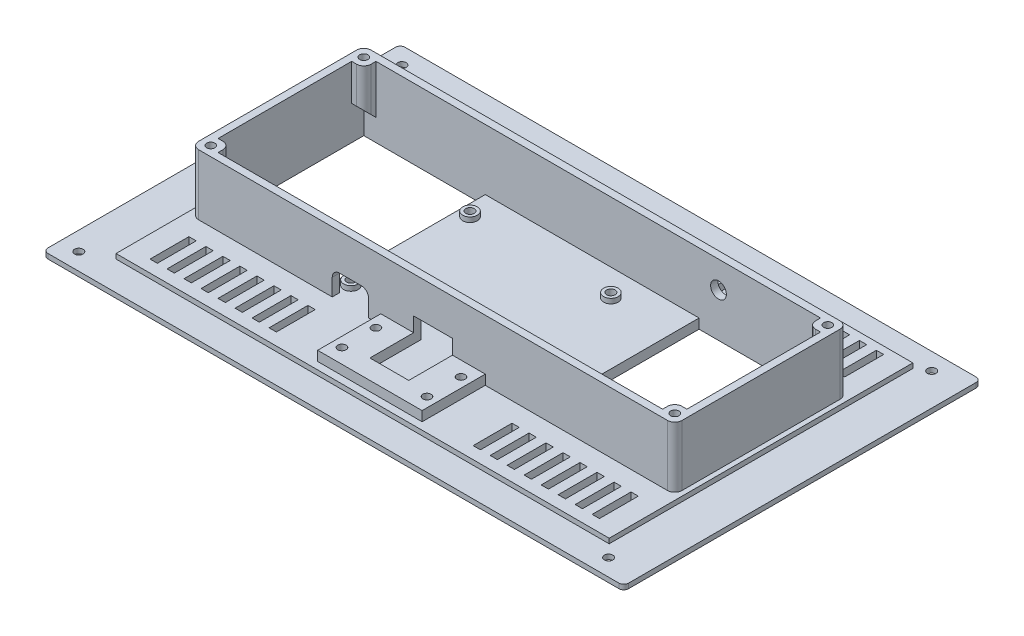
from build123d import *

# Parameters (mm, degrees)
SKIZZE1_W                            = 239
SKIZZE1_H                            = 147
AUFSATZ_LINEAR_AUSTRAGEN1_DEPTH      = 4
SKIZZE5_R                            = 3
AUFSATZ_LINEAR_AUSTRAGEN3_DEPTH      = 2
SKIZZE2_W                            = 199
SKIZZE2_H                            = 71
SKIZZE2_W_2                          = 193
SKIZZE2_H_2                          = 65
AUFSATZ_LINEAR_AUSTRAGEN2_DEPTH      = 25
SKIZZE3_W                            = 50
SKIZZE3_H                            = 65
SKIZZE3_W_2                          = 55
SCHNITT_LINEAR_AUSTRAGEN1_DEPTH      = 282.700195243
F_3_5_3_5_DURCHMESSER_BOHRUNG1_D     = 3.5
F_3_5_3_5_DURCHMESSER_BOHRUNG2_D     = 3.5
SCHNITT_LINEAR_AUSTRAGEN2_REACH      = 265.055
SKIZZE10_W                           = 15
SKIZZE10_H                           = 10
VERRUNDUNG2_R                        = 3
SCHNITT_LINEAR_AUSTRAGEN3_REACH      = 267.53
SKIZZE11_R                           = 3.25
SKIZZE12_W                           = 5
SKIZZE12_H                           = 5
AUFSATZ_LINEAR_AUSTRAGEN4_DEPTH      = 20
FASE1_SIZE                           = 5
F_3_4_3_4_DURCHMESSER_BOHRUNG1_D     = 3.4
F_3_4_3_4_DURCHMESSER_BOHRUNG1_DEPTH = 8
F_3_4_3_4_DURCHMESSER_BOHRUNG1_TIP   = 1.021463052
VERRUNDUNG3_R                        = 3
SKIZZE17_W                           = 43
SKIZZE17_H                           = 26
AUFSATZ_LINEAR_AUSTRAGEN5_DEPTH      = 4
F_3_4_3_4_DURCHMESSER_BOHRUNG2_D     = 3.4
F_3_4_3_4_DURCHMESSER_BOHRUNG2_DEPTH = 6
F_3_4_3_4_DURCHMESSER_BOHRUNG2_TIP   = 1.021463052
SCHNITT_LINEAR_AUSTRAGEN4_DEPTH      = 6
SCHNITT_LINEAR_AUSTRAGEN4_DEPTH_BACK = 4
SKIZZE20_W                           = 16
SKIZZE20_H                           = 21
SCHNITT_LINEAR_AUSTRAGEN5_REACH      = 283.7
SKIZZE21_W                           = 3
SKIZZE21_H                           = 16
LINEARES_MUSTER1_COUNT               = 27
LINEARES_MUSTER1_PITCH               = 7
SCHNITT_LINEAR_AUSTRAGEN6_REACH      = 283.7
SKIZZE22_W                           = 3
SKIZZE22_H                           = 16
LINEARES_MUSTER2_COUNT               = 8
LINEARES_MUSTER2_PITCH               = 7
SCHNITT_LINEAR_AUSTRAGEN7_REACH      = 283.7
SKIZZE23_W                           = 3
SKIZZE23_H                           = 16
LINEARES_MUSTER3_COUNT               = 8
LINEARES_MUSTER3_PITCH               = 7
SKIZZE24_W                           = 239
SKIZZE24_H                           = 147
SKIZZE24_W_2                         = 203
SKIZZE24_H_2                         = 125
SCHNITT_LINEAR_AUSTRAGEN8_DEPTH      = 2
VERRUNDUNG4_R                        = 2


with BuildPart() as part:
    # Skizze1 → Aufsatz-Linear austragen1 (new body)
    with BuildSketch(Plane(origin=(0, 0, 0), x_dir=(1, 0, 0), z_dir=(0, 1, 0))):
        with Locations((119.5, 73.5)):
            Rectangle(SKIZZE1_W, SKIZZE1_H)
    extrude(amount=AUFSATZ_LINEAR_AUSTRAGEN1_DEPTH)

    # Skizze5 → Aufsatz-Linear austragen3 (add)
    with BuildSketch(Plane(origin=(0, 4, 0), x_dir=(1, 0, 0), z_dir=(0, 1, 0))):
        with Locations(Location((77.72, 98, 0), (0, 0, 270))):
            Circle(SKIZZE5_R)
        with Locations(Location((135.72, 98, 0), (0, 0, 270))):
            Circle(SKIZZE5_R)
        with Locations(Location((77.72, 49, 0), (0, 0, 270))):
            Circle(SKIZZE5_R)
        with Locations(Location((135.72, 49, 0), (0, 0, 270))):
            Circle(SKIZZE5_R)
    extrude(amount=AUFSATZ_LINEAR_AUSTRAGEN3_DEPTH)

    # Skizze2 → Aufsatz-Linear austragen2 (add)
    with BuildSketch(Plane(origin=(0, 4, 0), x_dir=(1, 0, 0), z_dir=(0, 1, 0))):
        with Locations((119.5, 76.5)):
            Rectangle(SKIZZE2_W, SKIZZE2_H)
        with Locations((119.5, 76.5)):
            Rectangle(SKIZZE2_W_2, SKIZZE2_H_2, mode=Mode.SUBTRACT)
    extrude(amount=AUFSATZ_LINEAR_AUSTRAGEN2_DEPTH)

    # Skizze3 → Schnitt-Linear austragen1 (cut, through all)
    with BuildSketch(Plane(origin=(0, 4, 0), x_dir=(1, 0, 0), z_dir=(0, 1, 0))):
        with Locations((48, 76.5)):
            Rectangle(SKIZZE3_W, SKIZZE3_H)
        with Locations((188.5, 76.5)):
            Rectangle(SKIZZE3_W_2, SKIZZE3_H)
    extrude(amount=-SCHNITT_LINEAR_AUSTRAGEN1_DEPTH, mode=Mode.SUBTRACT)

    # Ø3.5 (3.5) Durchmesser Bohrung1 (through all)
    with Locations(Plane(origin=(0, 4, 0), x_dir=(1, 0, 0), z_dir=(0, 1, 0))):
        with Locations((7.67, 140), (225.77, 140), (225.77, 7), (7.67, 7)):
            Hole(F_3_5_3_5_DURCHMESSER_BOHRUNG1_D / 2)

    # Ø3.5 (3.5) Durchmesser Bohrung2 (through all)
    with Locations(Plane(origin=(0, 6, 0), x_dir=(1, 0, 0), z_dir=(0, 1, 0))):
        with Locations((77.72, 98), (135.72, 98), (135.72, 49), (77.72, 49)):
            Hole(F_3_5_3_5_DURCHMESSER_BOHRUNG2_D / 2)

    # Skizze10 → Schnitt-Linear austragen2 (cut, up to next)
    with BuildSketch(Plane.XY.offset(-41), mode=Mode.PRIVATE) as schnitt_linear_austragen2_sk1:
        with Locations((85.5, 9)):
            Rectangle(SKIZZE10_W, SKIZZE10_H)
    schnitt_linear_austragen2_tool1 = extrude(schnitt_linear_austragen2_sk1.sketch, amount=-SCHNITT_LINEAR_AUSTRAGEN2_REACH, mode=Mode.PRIVATE) & part.part
    add(schnitt_linear_austragen2_tool1.solids().sort_by_distance((85.5, 9, -41))[0], mode=Mode.SUBTRACT)

    # Verrundung2
    verrundung2_edges = [part.edges().sort_by_distance(p)[0] for p in [
        (78, 14, -42.5),
        (93, 14, -42.5),
    ]]
    fillet(verrundung2_edges, radius=VERRUNDUNG2_R)

    # Skizze11 → Schnitt-Linear austragen3 (cut, up to next)
    with BuildSketch(Plane(origin=(0, 0, -112), x_dir=(-1, 0, 0), z_dir=(0, 0, -1)), mode=Mode.PRIVATE) as schnitt_linear_austragen3_sk1:
        with Locations((-169, 18)):
            Circle(SKIZZE11_R)
    schnitt_linear_austragen3_tool1 = extrude(schnitt_linear_austragen3_sk1.sketch, amount=-SCHNITT_LINEAR_AUSTRAGEN3_REACH, mode=Mode.PRIVATE) & part.part
    add(schnitt_linear_austragen3_tool1.solids().sort_by_distance((169, 18, -112))[0], mode=Mode.SUBTRACT)

    # Skizze12 → Aufsatz-Linear austragen4 (add)
    with BuildSketch(Plane(origin=(0, 29, 0), x_dir=(1, 0, 0), z_dir=(0, 1, 0))):
        with Locations((25.5, 106.5)):
            Rectangle(SKIZZE12_W, SKIZZE12_H)
        with Locations((25.5, 46.5)):
            Rectangle(SKIZZE12_W, SKIZZE12_H)
        with Locations((213.5, 106.5)):
            Rectangle(SKIZZE12_W, SKIZZE12_H)
        with Locations((213.5, 46.5)):
            Rectangle(SKIZZE12_W, SKIZZE12_H)
    extrude(amount=-AUFSATZ_LINEAR_AUSTRAGEN4_DEPTH)

    # Fase1
    fase1_edges = [part.edges().sort_by_distance(p)[0] for p in [
        (25.5, 9, -104),
        (25.5, 9, -49),
        (213.5, 9, -49),
        (213.5, 9, -104),
    ]]
    chamfer(fase1_edges, length=FASE1_SIZE - 0.0001)  # a hair under: the kernel refuses the full size

    # Ø3.4 (3.4) Durchmesser Bohrung1
    with Locations(Plane(origin=(0, 29, 0), x_dir=(1, 0, 0), z_dir=(0, 1, 0))):
        with Locations((24, 108), (215, 108), (215, 45), (24, 45)):
            Hole(F_3_4_3_4_DURCHMESSER_BOHRUNG1_D / 2, depth=F_3_4_3_4_DURCHMESSER_BOHRUNG1_DEPTH)
            with Locations((0, 0, -(F_3_4_3_4_DURCHMESSER_BOHRUNG1_DEPTH + F_3_4_3_4_DURCHMESSER_BOHRUNG1_TIP / 2))):  # 118° drill point
                Cone(0, F_3_4_3_4_DURCHMESSER_BOHRUNG1_D / 2, F_3_4_3_4_DURCHMESSER_BOHRUNG1_TIP, mode=Mode.SUBTRACT)

    # Verrundung3
    verrundung3_edges = [part.edges().sort_by_distance(p)[0] for p in [
        (28, 21.49995, -49),
        (211, 21.49995, -49),
        (211, 21.49995, -104),
        (28, 21.49995, -104),
        (20, 16.5, -112),
        (20, 16.5, -41),
        (219, 16.5, -41),
        (219, 16.5, -112),
    ]]
    fillet(verrundung3_edges, radius=VERRUNDUNG3_R)

    # Skizze17 → Aufsatz-Linear austragen5 (add)
    with BuildSketch(Plane(origin=(0, 4, 0), x_dir=(1, 0, 0), z_dir=(0, 1, 0))):
        with Locations((119.5, 28)):
            Rectangle(SKIZZE17_W, SKIZZE17_H)
    extrude(amount=AUFSATZ_LINEAR_AUSTRAGEN5_DEPTH)

    # Ø3.4 (3.4) Durchmesser Bohrung2
    with Locations(Plane(origin=(0, 8, 0), x_dir=(1, 0, 0), z_dir=(0, 1, 0))):
        with Locations((102, 35), (137, 35), (137, 21), (102, 21)):
            Hole(F_3_4_3_4_DURCHMESSER_BOHRUNG2_D / 2, depth=F_3_4_3_4_DURCHMESSER_BOHRUNG2_DEPTH)
            with Locations((0, 0, -(F_3_4_3_4_DURCHMESSER_BOHRUNG2_DEPTH + F_3_4_3_4_DURCHMESSER_BOHRUNG2_TIP / 2))):  # 118° drill point
                Cone(0, F_3_4_3_4_DURCHMESSER_BOHRUNG2_D / 2, F_3_4_3_4_DURCHMESSER_BOHRUNG2_TIP, mode=Mode.SUBTRACT)

    # Skizze20 → Schnitt-Linear austragen4 (cut, two sides: drawn at the far end of the back side and taken through both)
    with BuildSketch(Plane(origin=(0, 8, 0), x_dir=(1, 0, 0), z_dir=(0, 1, 0)).offset(-SCHNITT_LINEAR_AUSTRAGEN4_DEPTH_BACK)):
        with Locations((119.5, 33.5)):
            Rectangle(SKIZZE20_W, SKIZZE20_H)
    extrude(amount=SCHNITT_LINEAR_AUSTRAGEN4_DEPTH + SCHNITT_LINEAR_AUSTRAGEN4_DEPTH_BACK, mode=Mode.SUBTRACT)

    # Skizze21 → Schnitt-Linear austragen5 (cut, up to next)
    with BuildSketch(Plane(origin=(0, 4, 0), x_dir=(1, 0, 0), z_dir=(0, 1, 0)), mode=Mode.PRIVATE) as schnitt_linear_austragen5_sk1:
        with Locations((28.5, 126)):
            Rectangle(SKIZZE21_W, SKIZZE21_H)
    schnitt_linear_austragen5_tool1 = extrude(schnitt_linear_austragen5_sk1.sketch, amount=-SCHNITT_LINEAR_AUSTRAGEN5_REACH, mode=Mode.PRIVATE) & part.part
    schnitt_linear_austragen5 = schnitt_linear_austragen5_tool1.solids().sort_by_distance((28.5, 4, -126))[0]
    add(schnitt_linear_austragen5, mode=Mode.SUBTRACT)

    # Lineares Muster1: Schnitt-Linear austragen5 ×27
    with Locations(*[(i * LINEARES_MUSTER1_PITCH, 0, 0) for i in range(1, LINEARES_MUSTER1_COUNT)]):
        add(schnitt_linear_austragen5, mode=Mode.SUBTRACT)

    # Skizze22 → Schnitt-Linear austragen6 (cut, up to next)
    with BuildSketch(Plane(origin=(0, 4, 0), x_dir=(1, 0, 0), z_dir=(0, 1, 0)), mode=Mode.PRIVATE) as schnitt_linear_austragen6_sk1:
        with Locations((28.5, 25)):
            Rectangle(SKIZZE22_W, SKIZZE22_H)
    schnitt_linear_austragen6_tool1 = extrude(schnitt_linear_austragen6_sk1.sketch, amount=-SCHNITT_LINEAR_AUSTRAGEN6_REACH, mode=Mode.PRIVATE) & part.part
    schnitt_linear_austragen6 = schnitt_linear_austragen6_tool1.solids().sort_by_distance((28.5, 4, -25))[0]
    add(schnitt_linear_austragen6, mode=Mode.SUBTRACT)

    # Lineares Muster2: Schnitt-Linear austragen6 ×8
    with Locations(*[(i * LINEARES_MUSTER2_PITCH, 0, 0) for i in range(1, LINEARES_MUSTER2_COUNT)]):
        add(schnitt_linear_austragen6, mode=Mode.SUBTRACT)

    # Skizze23 → Schnitt-Linear austragen7 (cut, up to next)
    with BuildSketch(Plane(origin=(0, 4, 0), x_dir=(1, 0, 0), z_dir=(0, 1, 0)), mode=Mode.PRIVATE) as schnitt_linear_austragen7_sk1:
        with Locations((210.5, 25)):
            Rectangle(SKIZZE23_W, SKIZZE23_H)
    schnitt_linear_austragen7_tool1 = extrude(schnitt_linear_austragen7_sk1.sketch, amount=-SCHNITT_LINEAR_AUSTRAGEN7_REACH, mode=Mode.PRIVATE) & part.part
    schnitt_linear_austragen7 = schnitt_linear_austragen7_tool1.solids().sort_by_distance((210.5, 4, -25))[0]
    add(schnitt_linear_austragen7, mode=Mode.SUBTRACT)

    # Lineares Muster3: Schnitt-Linear austragen7 ×8
    with Locations(*[(-i * LINEARES_MUSTER3_PITCH, 0, 0) for i in range(1, LINEARES_MUSTER3_COUNT)]):
        add(schnitt_linear_austragen7, mode=Mode.SUBTRACT)

    # Skizze24 → Schnitt-Linear austragen8 (cut)
    with BuildSketch(Plane(origin=(0, 4, 0), x_dir=(1, 0, 0), z_dir=(0, 1, 0))):
        with Locations((119.5, 73.5)):
            Rectangle(SKIZZE24_W, SKIZZE24_H)
        with Locations((119.5, 74.5)):
            Rectangle(SKIZZE24_W_2, SKIZZE24_H_2, mode=Mode.SUBTRACT)
    extrude(amount=-SCHNITT_LINEAR_AUSTRAGEN8_DEPTH, mode=Mode.SUBTRACT)

    # Verrundung4
    verrundung4_edges = [part.edges().sort_by_distance(p)[0] for p in [
        (0, 1, -147),
        (239, 1, -147),
        (239, 1, 0),
        (0, 1, 0),
    ]]
    fillet(verrundung4_edges, radius=VERRUNDUNG4_R)


solid = part.part
